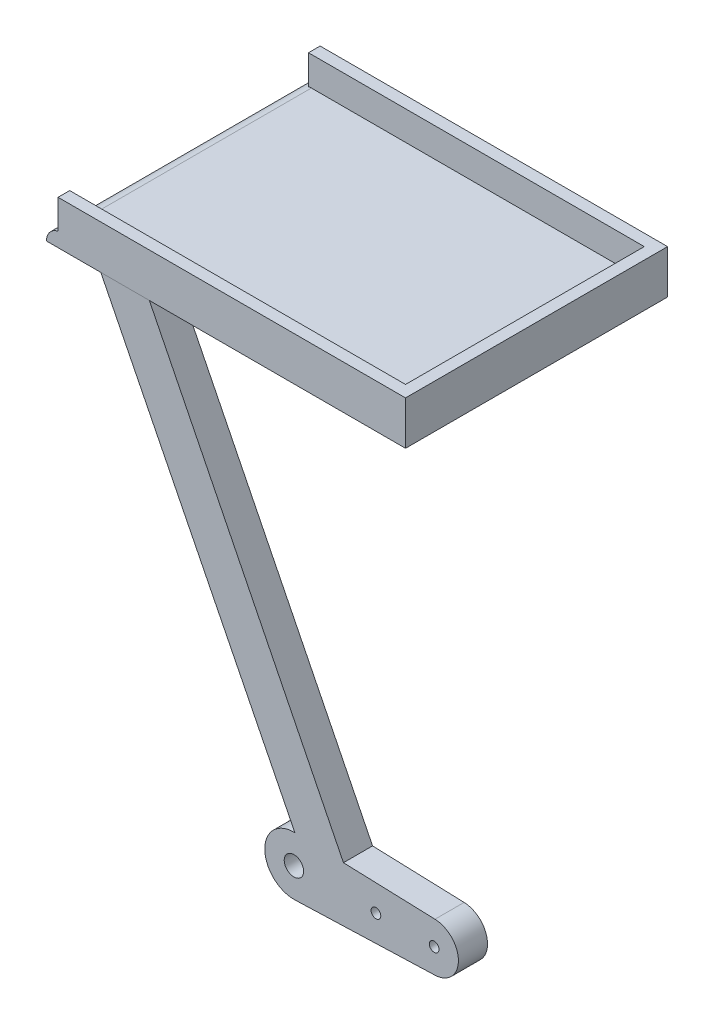
from build123d import *

# Parameters (mm, degrees)
SKETCH1_R           = 1
SKETCH1_R_2         = 0.5
BOSS_EXTRUDE1_DEPTH = 3
SKETCH4_W           = 37
SKETCH4_H           = 27
BOSS_EXTRUDE3_DEPTH = 1.5
BOSS_EXTRUDE4_DEPTH = 3
FILLET1_R           = 1.5


with BuildPart() as part:
    # Sketch1 → Boss-Extrude1 (new body)
    with BuildSketch(Plane.XY):
        with BuildLine():
            Line((0.103806228, -2.998203507), (14.53650519, -2.498502922))
            ThreePointArc((14.53650519, -2.498502922), (16.95, 0), (14.53650519, 2.498502922))
            Line((14.53650519, 2.498502922), (5.103806228, 2.82508946))
            Line((5.103806228, 2.82508946), (-14.896193772, 42.998203507))
            Line((-14.896193772, 42.998203507), (-19.896193772, 42.998203507))
            Line((-19.896193772, 42.998203507), (0.103806228, 2.998203507))
            ThreePointArc((0.103806228, 2.998203507), (-3, 0), (0.103806228, -2.998203507))
        make_face()
        Circle(SKETCH1_R, mode=Mode.SUBTRACT)
        with Locations((8.45, 0)):
            Circle(SKETCH1_R_2, mode=Mode.SUBTRACT)
        with Locations((14.45, 0)):
            Circle(SKETCH1_R_2, mode=Mode.SUBTRACT)
    extrude(amount=BOSS_EXTRUDE1_DEPTH)


with BuildPart() as body_2:
    # Sketch4 → Boss-Extrude3 (new body)
    with BuildSketch(Plane(origin=(0, 42.998203507, 0), x_dir=(1, 0, 0), z_dir=(0, 1, 0))):
        with Locations((-7, 10.5)):
            Rectangle(SKETCH4_W, SKETCH4_H)
    extrude(amount=BOSS_EXTRUDE3_DEPTH)

    # Sketch5 → Boss-Extrude4 (add)
    with BuildSketch(Plane(origin=(0, 44.498203507, 0), x_dir=(1, 0, 0), z_dir=(0, 1, 0))):
        Polygon((-24.3, 22.8), (-24.3, 24), (11.5, 24), (11.5, -3), (-24.3, -3), (-24.3, -1.8), (10.3, -1.8), (10.3, 22.8), align=None)
    extrude(amount=BOSS_EXTRUDE4_DEPTH)

    # Fillet1
    fillet1_edges = [body_2.edges().sort_by_distance(p)[0] for p in [
        (-25.5, 44.498203507, -10.5),
    ]]
    fillet(fillet1_edges, radius=FILLET1_R - 0.0001)  # a hair under: the kernel refuses the full size


solid = Compound([part.part, body_2.part])
